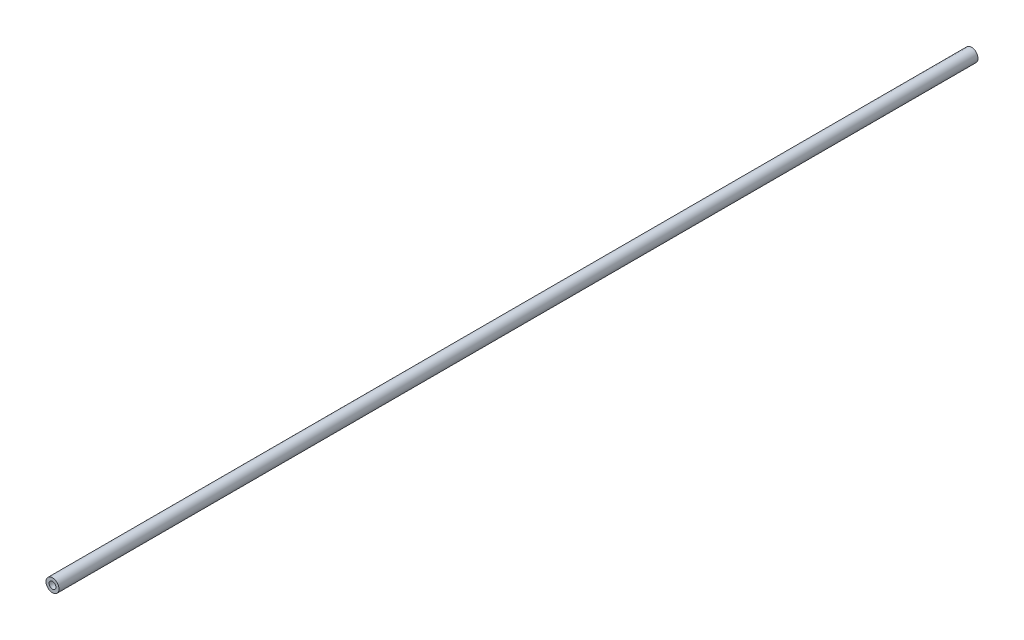
from build123d import *

# Parameters (mm, degrees)
SKETCH1_R           = 4.7625
SKETCH1_R_2         = 2.4892
BOSS_EXTRUDE1_DEPTH = 673.1


with BuildPart() as part:
    # Sketch1 → Boss-Extrude1 (new body)
    with BuildSketch(Plane.XY):
        Circle(SKETCH1_R)
        Circle(SKETCH1_R_2, mode=Mode.SUBTRACT)
    extrude(amount=-BOSS_EXTRUDE1_DEPTH)


solid = part.part
